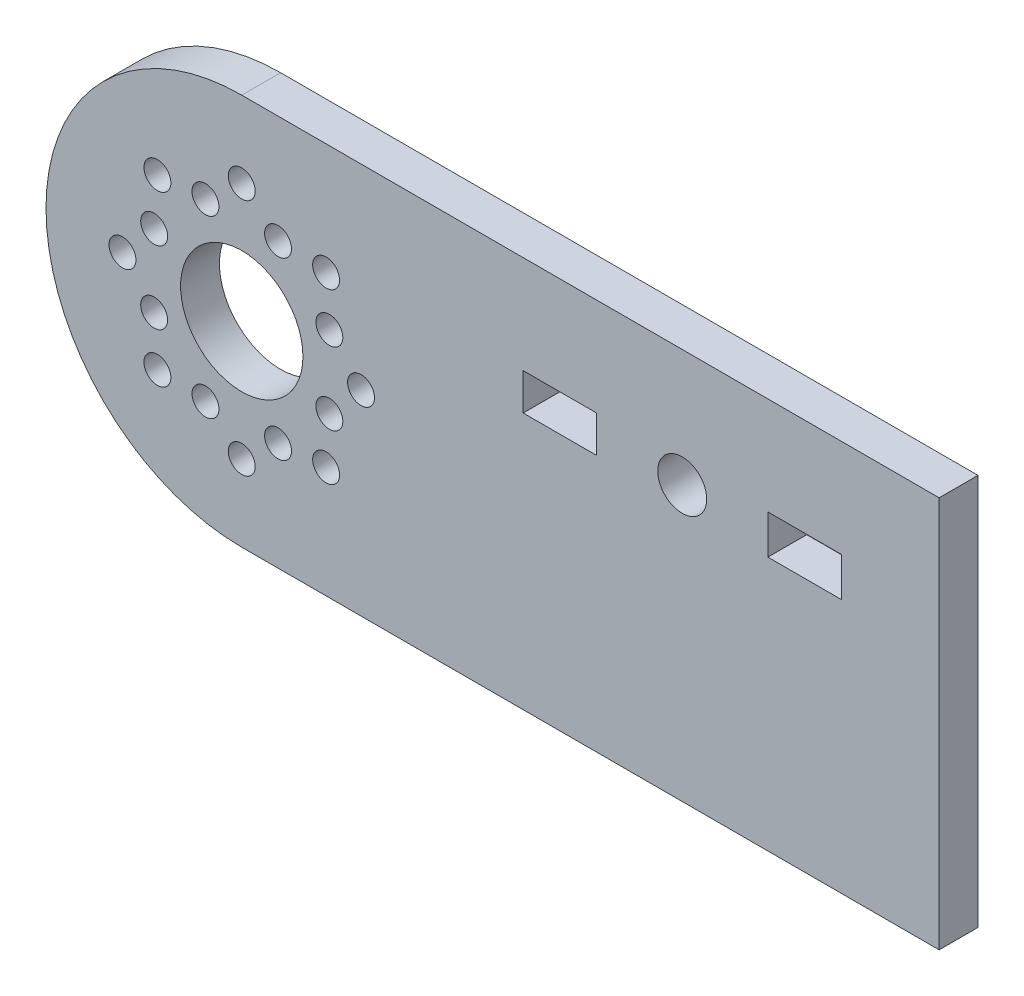
from build123d import *

# Parameters (mm, degrees)
SKETCH1_R           = 1.1
SKETCH1_R_2         = 5
SKETCH1_R_3         = 2
SKETCH1_W           = 6
SKETCH1_H           = 3
SKETCH1_H_2         = 3.2004
BOSS_EXTRUDE1_DEPTH = 3.175


with BuildPart() as part:
    # Sketch1 → Boss-Extrude1 (new body)
    with BuildSketch(Plane.XY):
        with BuildLine():
            Line((19, 0), (76, 0))
            Line((76, 0), (76, 32))
            Line((76, 32), (19, 32))
            ThreePointArc((19, 32), (3, 16), (19, 0))
        make_face()
        with Locations((25.894291117, 22.894291117)):
            Circle(SKETCH1_R, mode=Mode.SUBTRACT)
        with Locations((19, 25.75)):
            Circle(SKETCH1_R, mode=Mode.SUBTRACT)
        with Locations((28.75, 16)):
            Circle(SKETCH1_R, mode=Mode.SUBTRACT)
        with Locations((25.894291117, 9.105708883)):
            Circle(SKETCH1_R, mode=Mode.SUBTRACT)
        with Locations((19, 6.25)):
            Circle(SKETCH1_R, mode=Mode.SUBTRACT)
        with Locations((12.105708883, 9.105708883)):
            Circle(SKETCH1_R, mode=Mode.SUBTRACT)
        with Locations((9.25, 16)):
            Circle(SKETCH1_R, mode=Mode.SUBTRACT)
        with Locations((12.105708883, 22.894291117)):
            Circle(SKETCH1_R, mode=Mode.SUBTRACT)
        with Locations((19, 16)):
            Circle(SKETCH1_R_2, mode=Mode.SUBTRACT)
        with Locations((26.160066377, 18.965796601)):
            Circle(SKETCH1_R, mode=Mode.SUBTRACT)
        with Locations((21.965796601, 23.160066377)):
            Circle(SKETCH1_R, mode=Mode.SUBTRACT)
        with Locations((26.160066377, 13.034203399)):
            Circle(SKETCH1_R, mode=Mode.SUBTRACT)
        with Locations((21.965796601, 8.839933623)):
            Circle(SKETCH1_R, mode=Mode.SUBTRACT)
        with Locations((16.034203399, 8.839933623)):
            Circle(SKETCH1_R, mode=Mode.SUBTRACT)
        with Locations((11.839933623, 13.034203399)):
            Circle(SKETCH1_R, mode=Mode.SUBTRACT)
        with Locations((11.839933623, 18.965796601)):
            Circle(SKETCH1_R, mode=Mode.SUBTRACT)
        with Locations((16.034203399, 23.160066377)):
            Circle(SKETCH1_R, mode=Mode.SUBTRACT)
        with Locations((55, 22.4)):
            Circle(SKETCH1_R_3, mode=Mode.SUBTRACT)
        with Locations((45, 22.5)):
            Rectangle(SKETCH1_W, SKETCH1_H, mode=Mode.SUBTRACT)
        with Locations((65, 22.3998)):
            Rectangle(SKETCH1_W, SKETCH1_H_2, mode=Mode.SUBTRACT)
    extrude(amount=BOSS_EXTRUDE1_DEPTH)


solid = part.part
